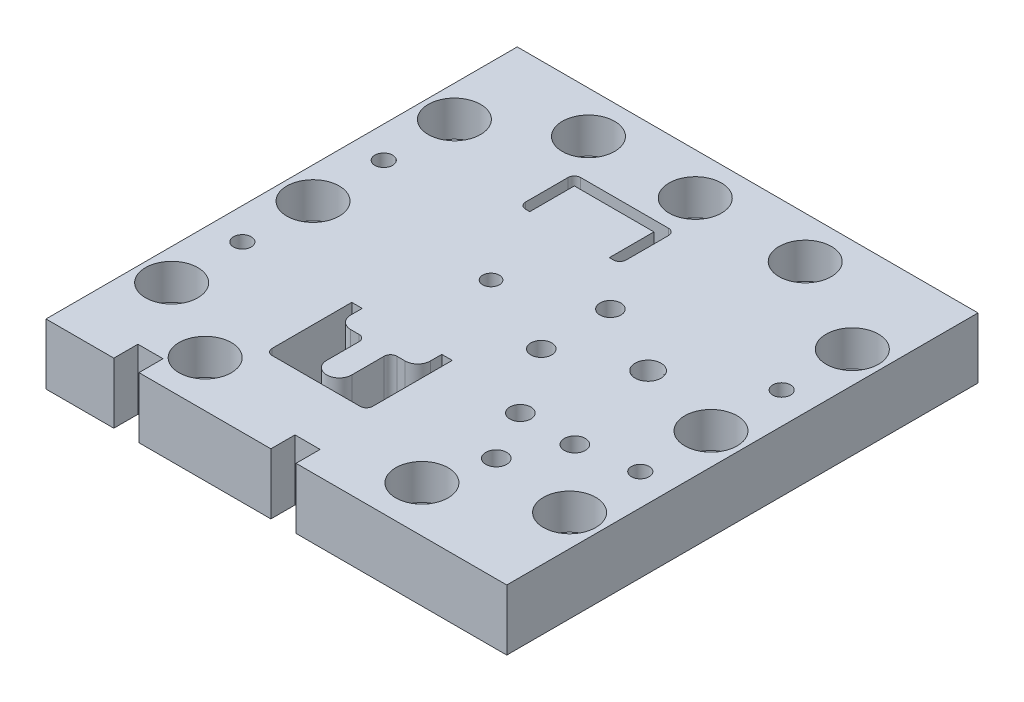
from build123d import *

# Parameters (mm, degrees)
SKETCH1_W                      = 220
SKETCH1_H                      = 225
BOSS_EXTRUDE1_DEPTH            = 29
CUT_EXTRUDE1_REACH             = 161.991
SKETCH2_R                      = 4
CUT_EXTRUDE2_REACH             = 161.991
SKETCH3_W                      = 12
SKETCH3_H                      = 11.5
LPATTERN1_COUNT                = 2
LPATTERN1_PITCH                = 75
SKETCH4_R                      = 8.5
CUT_EXTRUDE3_DEPTH             = 5
F_25_0_25_DIAMETER_HOLE3_D     = 25
F_25_0_25_DIAMETER_HOLE3_DEPTH = 17
F_25_0_25_DIAMETER_HOLE2_D     = 25
F_25_0_25_DIAMETER_HOLE2_DEPTH = 17
F_25_0_25_DIAMETER_HOLE1_D     = 25
F_25_0_25_DIAMETER_HOLE1_DEPTH = 17
CUT_EXTRUDE4_REACH             = 161.991
CUT_EXTRUDE6_REACH             = 161.991
F_10_0_10_DIAMETER_HOLE1_D     = 10
CUT_EXTRUDE7_REACH             = 161.991
SKETCH34_R                     = 5
M10_TAPPED_HOLE1_D             = 8.5


with BuildPart() as part:
    # Sketch1 → Boss-Extrude1 (new body)
    with BuildSketch(Plane(origin=(0, 0, 0), x_dir=(1, 0, 0), z_dir=(0, 1, 0))):
        Rectangle(SKETCH1_W, SKETCH1_H)
    extrude(amount=-BOSS_EXTRUDE1_DEPTH)

    # Sketch2 → Cut-Extrude1 (cut, up to next)
    with BuildSketch(Plane(origin=(0, 0, 0), x_dir=(1, 0, 0), z_dir=(0, 1, 0)), mode=Mode.PRIVATE) as cut_extrude1_sk1:
        with Locations((-19.87, 9.86)):
            Circle(SKETCH2_R)
    cut_extrude1_tool1 = extrude(cut_extrude1_sk1.sketch, amount=-CUT_EXTRUDE1_REACH, mode=Mode.PRIVATE) & part.part
    add(cut_extrude1_tool1.solids().sort_by_distance((-19.87, 0, -9.86))[0], mode=Mode.SUBTRACT)

    # Sketch3 → Cut-Extrude2 (cut, up to next)
    with BuildSketch(Plane.XZ.offset(29), mode=Mode.PRIVATE) as cut_extrude2_sk1:
        with Locations((3.38, 106.75)):
            Rectangle(SKETCH3_W, SKETCH3_H)
    cut_extrude2_tool1 = extrude(cut_extrude2_sk1.sketch, amount=-CUT_EXTRUDE2_REACH, mode=Mode.PRIVATE) & part.part
    cut_extrude2 = cut_extrude2_tool1.solids().sort_by_distance((3.38, -29, 106.75))[0]
    add(cut_extrude2, mode=Mode.SUBTRACT)

    # LPattern1: Cut-Extrude2 ×2
    with Locations(*[(-i * LPATTERN1_PITCH, 0, 0) for i in range(1, LPATTERN1_COUNT)]):
        add(cut_extrude2, mode=Mode.SUBTRACT)

    # Sketch4 → Cut-Extrude3 (cut)
    with BuildSketch(Plane.XZ.offset(29)):
        with Locations((-19.87, 100)):
            Circle(SKETCH4_R)
        with Locations((25, 100)):
            Circle(SKETCH4_R)
        with Locations((70, 100)):
            Circle(SKETCH4_R)
        with Locations((-19.87, -100)):
            Circle(SKETCH4_R)
        with Locations((25, -100)):
            Circle(SKETCH4_R)
        with Locations((70, -100)):
            Circle(SKETCH4_R)
        with Locations((-94.87, 100)):
            Circle(SKETCH4_R)
        with Locations((-94.87, -100)):
            Circle(SKETCH4_R)
    extrude(amount=-CUT_EXTRUDE3_DEPTH, mode=Mode.SUBTRACT)

    # Ø25.0 (25) Diameter Hole3
    with Locations(Plane(origin=(0, 0, 0), x_dir=(1, 0, 0), z_dir=(0, 1, 0))):
        with Locations((-95, -67.5), (-95, 0), (-95, 67.5), (95, 67.5), (95, 0), (95, -67.5)):
            Hole(F_25_0_25_DIAMETER_HOLE3_D / 2, depth=F_25_0_25_DIAMETER_HOLE3_DEPTH)

    # Ø25.0 (25) Diameter Hole2
    with Locations(Plane(origin=(0, 0, 0), x_dir=(1, 0, 0), z_dir=(0, 1, 0))):
        with Locations((-56, 92.5), (-5, 92.5), (47.5, 92.5)):
            Hole(F_25_0_25_DIAMETER_HOLE2_D / 2, depth=F_25_0_25_DIAMETER_HOLE2_DEPTH)

    # Ø25.0 (25) Diameter Hole1
    with Locations(Plane(origin=(0, 0, 0), x_dir=(1, 0, 0), z_dir=(0, 1, 0))):
        with Locations((47.5, -90.5), (-56, -90.5)):
            Hole(F_25_0_25_DIAMETER_HOLE1_D / 2, depth=F_25_0_25_DIAMETER_HOLE1_DEPTH)

    # Sketch24 → Cut-Extrude4 (cut, up to next)
    with BuildSketch(Plane(origin=(0, 0, 0), x_dir=(1, 0, 0), z_dir=(0, 1, 0)), mode=Mode.PRIVATE) as cut_extrude4_sk1:
        with BuildLine():
            Line((4.13, -32.64), (-0.87, -32.64))
            Line((-0.87, -32.64), (-0.87, -38.14))
            ThreePointArc((-0.87, -38.14), (-2.627359313, -42.382640687), (-6.87, -44.14))
            Line((-6.87, -44.14), (-10.87, -44.14))
            ThreePointArc((-10.87, -44.14), (-12.991320344, -45.018679656), (-13.87, -47.14))
            Line((-13.87, -47.14), (-13.87, -62.64))
            ThreePointArc((-13.87, -62.64), (-19.87, -68.64), (-25.87, -62.64))
            Line((-25.87, -62.64), (-25.87, -47.14))
            ThreePointArc((-25.87, -47.14), (-26.748679656, -45.018679656), (-28.87, -44.14))
            Line((-28.87, -44.14), (-32.87, -44.14))
            ThreePointArc((-32.87, -44.14), (-37.112640687, -42.382640687), (-38.87, -38.14))
            Line((-38.87, -38.14), (-38.87, -32.64))
            Line((-38.87, -32.64), (-43.87, -32.64))
            Line((-43.87, -32.64), (-43.87, -70.64))
            ThreePointArc((-43.87, -70.64), (-42.991320344, -72.761320344), (-40.87, -73.64))
            Line((-40.87, -73.64), (1.13, -73.64))
            ThreePointArc((1.13, -73.64), (3.251320344, -72.761320344), (4.13, -70.64))
            Line((4.13, -70.64), (4.13, -32.64))
        make_face()
    cut_extrude4_tool1 = extrude(cut_extrude4_sk1.sketch, amount=-CUT_EXTRUDE4_REACH, mode=Mode.PRIVATE) & part.part
    add(cut_extrude4_tool1.solids().sort_by_distance((3.498731, 0, 51.64))[0], mode=Mode.SUBTRACT)

    # Sketch29 → Cut-Extrude6 (cut, up to next)
    with BuildSketch(Plane.XZ.offset(29), mode=Mode.PRIVATE) as cut_extrude6_sk1:
        with BuildLine():
            Line((-0.87, -47.36), (1.13, -47.36))
            ThreePointArc((1.13, -47.36), (3.251320344, -48.238679656), (4.13, -50.36))
            Line((4.13, -50.36), (4.13, -70.64))
            ThreePointArc((4.13, -70.64), (3.251320344, -72.761320344), (1.13, -73.64))
            Line((1.13, -73.64), (-40.87, -73.64))
            ThreePointArc((-40.87, -73.64), (-42.991320344, -72.761320344), (-43.87, -70.64))
            Line((-43.87, -70.64), (-43.87, -50.36))
            ThreePointArc((-43.87, -50.36), (-42.991320344, -48.238679656), (-40.87, -47.36))
            Line((-40.87, -47.36), (-38.87, -47.36))
            Line((-38.87, -47.36), (-38.87, -68.64))
            Line((-38.87, -68.64), (-0.87, -68.64))
            Line((-0.87, -68.64), (-0.87, -47.36))
        make_face()
    cut_extrude6_tool1 = extrude(cut_extrude6_sk1.sketch, amount=-CUT_EXTRUDE6_REACH, mode=Mode.PRIVATE) & part.part
    add(cut_extrude6_tool1.solids().sort_by_distance((0.13, -29, -47.907233))[0], mode=Mode.SUBTRACT)

    # Ø10.0 (10) Diameter Hole1 (through all)
    with Locations(Plane(origin=(0, 0, 0), x_dir=(1, 0, 0), z_dir=(0, 1, 0))):
        with Locations((55.13, -62.64), (68.13, -38.14), (42.13, -38.14), (20.63, 26.36), (20.63, -6.64)):
            Hole(F_10_0_10_DIAMETER_HOLE1_D / 2)

    # Sketch34 → Cut-Extrude7 (cut, up to next)
    with BuildSketch(Plane(origin=(0, 0, 0), x_dir=(1, 0, 0), z_dir=(0, 1, 0)), mode=Mode.PRIVATE) as cut_extrude7_sk1:
        with Locations((55.13, 9.86)):
            Circle(SKETCH34_R)
    cut_extrude7_tool1 = extrude(cut_extrude7_sk1.sketch, amount=-CUT_EXTRUDE7_REACH, mode=Mode.PRIVATE) & part.part
    add(cut_extrude7_tool1.solids().sort_by_distance((55.13, 0, -9.86))[0], mode=Mode.SUBTRACT)

    # Cut-Sweep1: sweep along a curve in space
    with BuildLine() as cut_sweep1_path:
        ThreePointArc((55.13, 0, -4.86), (58.665533906, 0, -6.324466094), (60.13, 0, -9.86))
        ThreePointArc((60.13, 0, -9.86), (58.665533906, 0, -13.395533906), (55.13, 0, -14.86))
        ThreePointArc((55.13, 0, -14.86), (51.594466094, 0, -13.395533906), (50.13, 0, -9.86))
        ThreePointArc((50.13, 0, -9.86), (51.594466094, 0, -6.324466094), (55.13, 0, -4.86))
    # Sketch35 → Cut-Sweep1 (sweep, cut)
    with BuildSketch(Plane.XY.offset(-9.86)):
        Polygon((60.13, -23), (61.335378924, 0), (60.13, 0), align=None)
    sweep(path=cut_sweep1_path.line, mode=Mode.SUBTRACT)

    # M10 Tapped Hole1 (through all)
    with Locations(Plane(origin=(0, 0, 0), x_dir=(1, 0, 0), z_dir=(0, 1, 0))):
        with Locations((-95, 33.75), (-95, -33.75), (95, -33.75), (95, 33.75)):
            Hole(M10_TAPPED_HOLE1_D / 2)


solid = part.part
